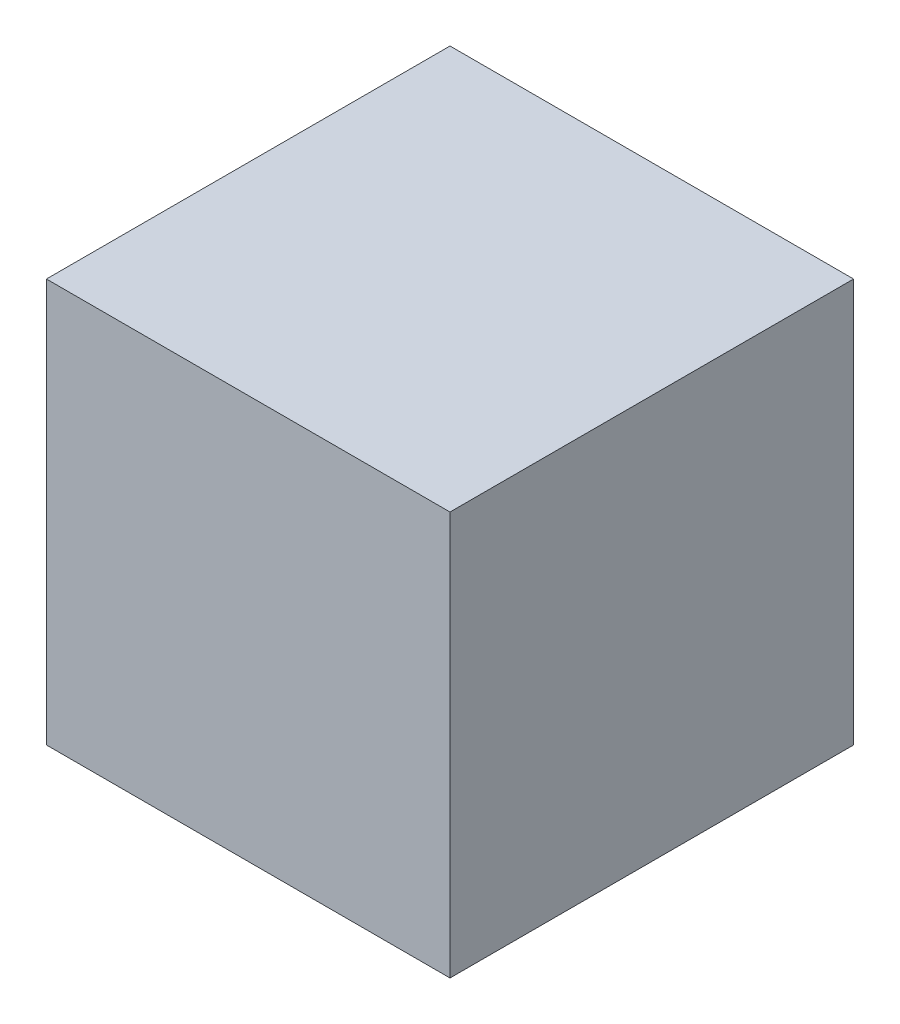
from build123d import *

# Parameters (mm, degrees)
SKETCH1_W           = 37
SKETCH1_H           = 37
BOSS_EXTRUDE1_DEPTH = 37


with BuildPart() as part:
    # Sketch1 → Boss-Extrude1 (new body)
    with BuildSketch(Plane.XY):
        with Locations((14.4, 14.638329701)):
            Rectangle(SKETCH1_W, SKETCH1_H)
    extrude(amount=BOSS_EXTRUDE1_DEPTH)


solid = part.part
